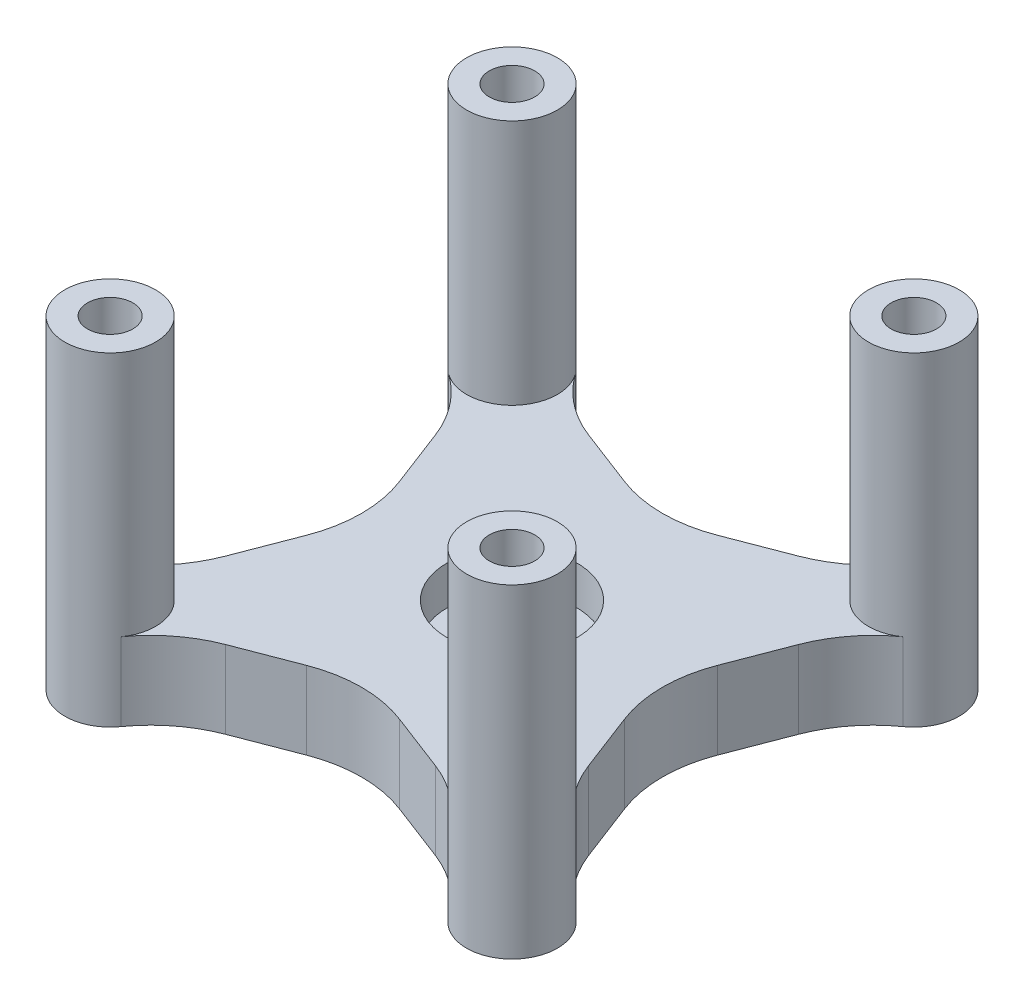
from build123d import *

# Parameters (mm, degrees)
SCHIZZO1_R                     = 3.5
SCHIZZO1_R_2                   = 1.75
ESTRUSIONE_ESTRUSIONE1_DEPTH   = 25
ESTRUSIONE_ESTRUSIONE1_2_DEPTH = 25
ESTRUSIONE_ESTRUSIONE1_3_DEPTH = 25
ESTRUSIONE_ESTRUSIONE1_4_DEPTH = 25
SCHIZZO1_3_R                   = 10.9
SCHIZZO1_3_R_2                 = 5
SCHIZZO1_3_R_3                 = 3
ESTRUSIONE_ESTRUSIONE2_DEPTH   = 3
ESTRUSIONE_ESTRUSIONE4_START   = 3
SCHIZZO1_5_R                   = 10.9
SCHIZZO1_5_R_2                 = 5
ESTRUSIONE_ESTRUSIONE4_DEPTH   = 3
RACCORDO1_R                    = 10


with BuildPart() as part:
    # Schizzo1 → Estrusione-Estrusione1 (new body)
    with BuildSketch(Plane(origin=(0, 0, 0), x_dir=(1, 0, 0), z_dir=(0, 1, 0))):
        with Locations(Location((-15.5, -15.5, 0), (0, 0, 270))):
            Circle(SCHIZZO1_R)
        with Locations(Location((-15.5, -15.5, 0), (0, 0, 270))):
            Circle(SCHIZZO1_R_2, mode=Mode.SUBTRACT)
    extrude(amount=ESTRUSIONE_ESTRUSIONE1_DEPTH)



with BuildPart() as body_2:
    # Schizzo1 → Estrusione-Estrusione1 2 (new body)
    with BuildSketch(Plane(origin=(0, 0, 0), x_dir=(1, 0, 0), z_dir=(0, 1, 0))):
        with Locations(Location((-15.5, 15.5, 0), (0, 0, 270))):
            Circle(SCHIZZO1_R)
        with Locations(Location((-15.5, 15.5, 0), (0, 0, 270))):
            Circle(SCHIZZO1_R_2, mode=Mode.SUBTRACT)
    extrude(amount=ESTRUSIONE_ESTRUSIONE1_2_DEPTH)


with BuildPart() as body_3:
    # Schizzo1 → Estrusione-Estrusione1 3 (new body)
    with BuildSketch(Plane(origin=(0, 0, 0), x_dir=(1, 0, 0), z_dir=(0, 1, 0))):
        with Locations(Location((15.5, 15.5, 0), (0, 0, 270))):
            Circle(SCHIZZO1_R)
        with Locations(Location((15.5, 15.5, 0), (0, 0, 270))):
            Circle(SCHIZZO1_R_2, mode=Mode.SUBTRACT)
    extrude(amount=ESTRUSIONE_ESTRUSIONE1_3_DEPTH)


with BuildPart() as body_4:
    # Schizzo1 → Estrusione-Estrusione1 4 (new body)
    with BuildSketch(Plane(origin=(0, 0, 0), x_dir=(1, 0, 0), z_dir=(0, 1, 0))):
        with Locations(Location((15.5, -15.5, 0), (0, 0, 270))):
            Circle(SCHIZZO1_R)
        with Locations(Location((15.5, -15.5, 0), (0, 0, 270))):
            Circle(SCHIZZO1_R_2, mode=Mode.SUBTRACT)
    extrude(amount=ESTRUSIONE_ESTRUSIONE1_4_DEPTH)


with BuildPart() as part_1:
    add(part.part)

    add(body_2.part)  # Estrusione-Estrusione2 merges body 2

    add(body_3.part)  # Estrusione-Estrusione2 merges body 3

    add(body_4.part)  # Estrusione-Estrusione2 merges body 4
    # Schizzo1<3> → Estrusione-Estrusione2 (add)
    # profile 1 of 6: a face of its own
    with BuildSketch(Plane(origin=(0, 0, 0), x_dir=(1, 0, 0), z_dir=(0, 1, 0))):
        with BuildLine():
            Line((-10.9, 0), (-15.5, -12))
            ThreePointArc((-15.5, -12), (-13.025126266, -13.025126266), (-12, -15.5))
            Line((-12, -15.5), (0, -10.9))
            ThreePointArc((0, -10.9), (-7.707463915, -7.707463915), (-10.9, 0))
        make_face()
    # profile 2 of 6: a face of its own
    with BuildSketch(Plane(origin=(0, 0, 0), x_dir=(1, 0, 0), z_dir=(0, 1, 0))):
        with BuildLine():
            ThreePointArc((10.9, 0), (7.707463915, -7.707463915), (0, -10.9))
            Line((0, -10.9), (12, -15.5))
            ThreePointArc((12, -15.5), (13.025126266, -13.025126266), (15.5, -12))
            Line((15.5, -12), (10.9, 0))
        make_face()
    # profile 3 of 6: a face of its own
    with BuildSketch(Plane(origin=(0, 0, 0), x_dir=(1, 0, 0), z_dir=(0, 1, 0))):
        with BuildLine():
            Line((12, 15.5), (0, 10.9))
            ThreePointArc((0, 10.9), (7.707463915, 7.707463915), (10.9, 0))
            Line((10.9, 0), (15.5, 12))
            ThreePointArc((15.5, 12), (13.025126266, 13.025126266), (12, 15.5))
        make_face()
    # profile 4 of 6: a face of its own
    with BuildSketch(Plane(origin=(0, 0, 0), x_dir=(1, 0, 0), z_dir=(0, 1, 0))):
        with BuildLine():
            Line((-15.5, 12), (-10.9, 0))
            ThreePointArc((-10.9, 0), (-7.707463915, 7.707463915), (0, 10.9))
            Line((0, 10.9), (-12, 15.5))
            ThreePointArc((-12, 15.5), (-13.025126266, 13.025126266), (-15.5, 12))
        make_face()
    # profile 5 of 6: a face of its own
    with BuildSketch(Plane(origin=(0, 0, 0), x_dir=(1, 0, 0), z_dir=(0, 1, 0))):
        Circle(SCHIZZO1_3_R)
        Circle(SCHIZZO1_3_R_2, mode=Mode.SUBTRACT)
    # profile 6 of 6: a face of its own
    with BuildSketch(Plane(origin=(0, 0, 0), x_dir=(1, 0, 0), z_dir=(0, 1, 0))):
        Circle(SCHIZZO1_3_R_2)
        with Locations(Location((0, 0, 0), (0, 0, 270))):
            Circle(SCHIZZO1_3_R_3, mode=Mode.SUBTRACT)
    extrude(amount=ESTRUSIONE_ESTRUSIONE2_DEPTH)

    # Schizzo1<5> → Estrusione-Estrusione4 (add)
    # profile 1 of 5: a face of its own
    with BuildSketch(Plane(origin=(0, 0, 0), x_dir=(1, 0, 0), z_dir=(0, 1, 0)).offset(ESTRUSIONE_ESTRUSIONE4_START)):
        Circle(SCHIZZO1_5_R)
        with Locations(Location((0, 0, 0), (0, 0, 270))):
            Circle(SCHIZZO1_5_R_2, mode=Mode.SUBTRACT)
    # profile 2 of 5: a face of its own
    with BuildSketch(Plane(origin=(0, 0, 0), x_dir=(1, 0, 0), z_dir=(0, 1, 0)).offset(ESTRUSIONE_ESTRUSIONE4_START)):
        with BuildLine():
            Line((-10.9, 0), (-15.5, -12))
            ThreePointArc((-15.5, -12), (-13.025126266, -13.025126266), (-12, -15.5))
            Line((-12, -15.5), (0, -10.9))
            ThreePointArc((0, -10.9), (-7.707463915, -7.707463915), (-10.9, 0))
        make_face()
    # profile 3 of 5: a face of its own
    with BuildSketch(Plane(origin=(0, 0, 0), x_dir=(1, 0, 0), z_dir=(0, 1, 0)).offset(ESTRUSIONE_ESTRUSIONE4_START)):
        with BuildLine():
            Line((-15.5, 12), (-10.9, 0))
            ThreePointArc((-10.9, 0), (-7.707463915, 7.707463915), (0, 10.9))
            Line((0, 10.9), (-12, 15.5))
            ThreePointArc((-12, 15.5), (-13.025126266, 13.025126266), (-15.5, 12))
        make_face()
    # profile 4 of 5: a face of its own
    with BuildSketch(Plane(origin=(0, 0, 0), x_dir=(1, 0, 0), z_dir=(0, 1, 0)).offset(ESTRUSIONE_ESTRUSIONE4_START)):
        with BuildLine():
            Line((12, 15.5), (0, 10.9))
            ThreePointArc((0, 10.9), (7.707463915, 7.707463915), (10.9, 0))
            Line((10.9, 0), (15.5, 12))
            ThreePointArc((15.5, 12), (13.025126266, 13.025126266), (12, 15.5))
        make_face()
    # profile 5 of 5: a face of its own
    with BuildSketch(Plane(origin=(0, 0, 0), x_dir=(1, 0, 0), z_dir=(0, 1, 0)).offset(ESTRUSIONE_ESTRUSIONE4_START)):
        with BuildLine():
            ThreePointArc((10.9, 0), (7.707463915, -7.707463915), (0, -10.9))
            Line((0, -10.9), (12, -15.5))
            ThreePointArc((12, -15.5), (13.025126266, -13.025126266), (15.5, -12))
            Line((15.5, -12), (10.9, 0))
        make_face()
    extrude(amount=ESTRUSIONE_ESTRUSIONE4_DEPTH)

    # Raccordo1
    # the kernel refuses this fillet: 10 mm, written as the material it adds along each edge
    with BuildSketch(Plane(origin=(-15.5, 0, 12), x_dir=(0.3579360116324522, 0, -0.9337461173020496), z_dir=(0, 1, 0)), Plane(origin=(15.5, 0, -12), x_dir=(-0.35793601163245214, 0, 0.9337461173020496), z_dir=(0, 1, 0)), Plane(origin=(-12, 0, -15.5), x_dir=(0.9337461173020497, 0, 0.35793601163245176), z_dir=(0, 1, 0))) as raccordo1_piece_1:
        with BuildLine():
            CenterArc((4.190107638, 10), RACCORDO1_R, 236.464010446, 33.535989554)
            ThreePointArc((-1.334499065, 1.66461034), (-0.537321341, 0.936467115), (0, 0))
            Line((0, 0), (4.190107638, 0))
        make_face()
    extrude(amount=6)
    with BuildSketch(Plane(origin=(-12, 0, 15.5), x_dir=(-0.3047854828813613, 0, 0.952421025295418), z_dir=(0, 1, 0)), Plane(origin=(12, 6, 15.5), x_dir=(0.30478548288135804, 0, 0.9524210252954193), z_dir=(0, -1, 0)), Plane(origin=(15.5, 0, 12), x_dir=(0.9524210252954187, 0, 0.3047854828813593), z_dir=(0, 1, 0)), Plane(origin=(12, 0, -15.5), x_dir=(0.30478548288136037, 0, -0.9524210252954185), z_dir=(0, 1, 0)), Plane(origin=(-15.5, 0, -12), x_dir=(-0.952421025295419, 0, -0.304785482881358), z_dir=(0, 1, 0))) as raccordo1_piece_2:
        with BuildLine():
            CenterArc((5.181353209, 9.524210253), RACCORDO1_R, 218.718751934, 33.535989554)
            Line((-2.620904134, 3.269229809), (0, 0))
            ThreePointArc((0, 0), (1.06674919, 0.166526411), (2.13349838, 0))
        make_face()
    extrude(amount=6)
    with BuildSketch(Plane(origin=(0, 6, 10.9), x_dir=(-0.9337461173020492, 0, 0.3579360116324534), z_dir=(0, -1, 0))) as raccordo1_piece_3:
        with BuildLine():
            CenterArc((RACCORDO1_R * 0.383333333333, -RACCORDO1_R), RACCORDO1_R, 90, 41.946986843)
            Line((-RACCORDO1_R * 0.285109388875, -RACCORDO1_R * 0.256236376847), (0, 0))
            Line((0, 0), (RACCORDO1_R * 0.383333333333, 0))
        make_face()
    extrude(amount=6)
    with BuildSketch(Plane(origin=(10.9, 0, 0), x_dir=(0.35793601163245314, 0, 0.9337461173020493), z_dir=(0, 1, 0)), Plane(origin=(0, 0, -10.9), x_dir=(0.9337461173020492, 0, -0.3579360116324533), z_dir=(0, 1, 0)), Plane(origin=(-10.9, 0, 0), x_dir=(-0.3579360116324529, 0, -0.9337461173020494), z_dir=(0, 1, 0))) as raccordo1_piece_4:
        with BuildLine():
            CenterArc((RACCORDO1_R * 0.383333333333, RACCORDO1_R), RACCORDO1_R, 228.053013157, 41.946986843)
            Line((-RACCORDO1_R * 0.285109388875, RACCORDO1_R * 0.256236376847), (0, 0))
            Line((0, 0), (RACCORDO1_R * 0.383333333333, 0))
        make_face()
    extrude(amount=6)


solid = part_1.part
